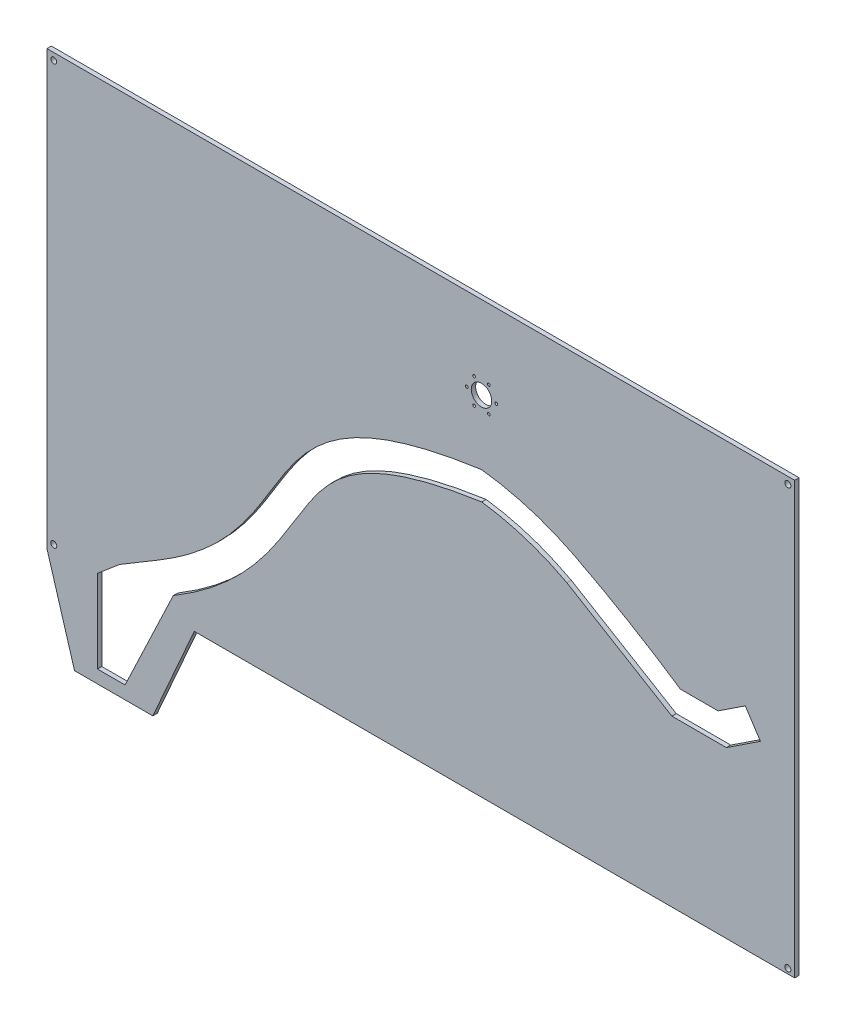
from build123d import *

# Parameters (mm, degrees)
SKETCH1_R           = 3.292374312
SKETCH1_R_2         = 3.294421934
SKETCH1_R_3         = 3.163533699
SKETCH1_R_4         = 1.5
SKETCH1_R_5         = 11.1125
BOSS_EXTRUDE1_DEPTH = 4.7625


with BuildPart() as part:
    # Sketch1 → Boss-Extrude1 (new body)
    with BuildSketch(Plane.XY):
        Polygon((-596.816755826, -150), (-566.816755826, -250), (-481.816755826, -250), (-436.816755826, -147.994392447), (215.080766979, -147.994392447), (215.080766979, 320), (-596.816755826, 320), align=None)
        with Locations((-589.375723826, -142.5578)):
            Circle(SKETCH1_R, mode=Mode.SUBTRACT)
        with Locations((207.642212326, -142.5578)):
            Circle(SKETCH1_R, mode=Mode.SUBTRACT)
        with Locations((207.642212326, 312.5578)):
            Circle(SKETCH1_R_2, mode=Mode.SUBTRACT)
        with Locations((-589.375723826, 312.5578)):
            Circle(SKETCH1_R_3, mode=Mode.SUBTRACT)
        with Locations((-141, 230)):
            Circle(SKETCH1_R_4, mode=Mode.SUBTRACT)
        with Locations((-133, 243.856406461)):
            Circle(SKETCH1_R_4, mode=Mode.SUBTRACT)
        with Locations((-117, 243.856406461)):
            Circle(SKETCH1_R_4, mode=Mode.SUBTRACT)
        with Locations((-109, 230)):
            Circle(SKETCH1_R_4, mode=Mode.SUBTRACT)
        with Locations((-117, 216.143593539)):
            Circle(SKETCH1_R_4, mode=Mode.SUBTRACT)
        with Locations((-133, 216.143593539)):
            Circle(SKETCH1_R_4, mode=Mode.SUBTRACT)
        with Locations((-125, 230)):
            Circle(SKETCH1_R_5, mode=Mode.SUBTRACT)
        with BuildLine():
            Line((-475, -100), (-518.031074044, -125.74437106))
            Line((-518.031074044, -125.74437106), (-541.975507322, -146))
            Line((-541.975507322, -146), (-541.975507322, -236))
            Line((-541.975507322, -236), (-511.975507322, -236))
            Line((-511.975507322, -236), (-459.597813184, -125.74437106))
            add(Edge.make_bspline(
                [(-459.597813184, -125.74437106), (-458.129207209, -124.865742348), (-455.185829054, -123.081513508), (-449.471359557, -119.524654219), (-442.555549408, -115.046151368), (-434.636214281, -109.639746192), (-424.556425744, -102.386073958), (-412.829398694, -93.24529863), (-400.055778993, -82.1905419), (-388.486450966, -71.092190732), (-374.537420018, -56.304576734), (-359.620141336, -37.979207276), (-344.890774823, -16.767556206), (-332.340078528, 3.245699555), (-321.055163892, 21.796443272), (-310.225956981, 38.664819129), (-299.079604806, 53.834809894), (-286.812791685, 67.514642691), (-272.431751915, 80.088460877), (-257.652665703, 89.924055398), (-243.498210685, 97.442015492), (-231.565093385, 102.886615769), (-218.172694067, 108.112662921), (-203.190999217, 113.087836875), (-189.281720356, 116.996077726), (-177.243425929, 119.962936855), (-167.745823902, 122.104113686), (-157.766000623, 124.157339904), (-149.036898589, 125.791853127), (-141.799270328, 127.051772068), (-136.243143266, 127.972296195), (-131.502167372, 128.719120718), (-127.648712651, 129.303231945), (-125.690331117, 129.592450023), (-124.714693771, 129.734664734)],
                knots=[0, 0, 0, 0, 0.00777259, 0.01554518, 0.03109036, 0.04663554, 0.062180721, 0.093271081, 0.124361441, 0.155451801, 0.186542162, 0.248722882, 0.310903603, 0.373084323, 0.435265044, 0.497445764, 0.559626485, 0.621807206, 0.683987926, 0.746168647, 0.777259007, 0.808349367, 0.839439728, 0.870530088, 0.901620448, 0.917165628, 0.932710808, 0.948255989, 0.963801169, 0.971573759, 0.979346349, 0.987118939, 0.991005234, 0.994891529, 0.994891529, 0.994891529, 0.994891529], degree=3))
            ThreePointArc((-124.714693771, 129.734664734), (-77.172123272, 119.052933104), (-32.323699215, 100))
            Line((-32.323699215, 100), (81.77450832, 31.56416045))
            Line((81.77450832, 31.56416045), (140.88780849, 31.56416045))
            Line((140.88780849, 31.56416045), (177.923308763, 55.973921994))
            Line((177.923308763, 55.973921994), (161.413907899, 81.022668132))
            Line((161.413907899, 81.022668132), (131.890654865, 61.56416045))
            Line((131.890654865, 61.56416045), (90.97120992, 61.56416045))
            ThreePointArc((90.97120992, 61.56416045), (35.57180112, 96.520479224), (-21.701372103, 128.313911667))
            Line((-21.701372103, 128.313911667), (-25, 130))
            ThreePointArc((-25, 130), (-73.684930832, 149.383563894), (-125, 160))
            add(Edge.make_bspline(
                [(-475, -100), (-419.540575809, -66.820070684), (-329.590802121, 43.11603253), (-307.635554762, 134.287094016), (-125, 160)],
                knots=[0, 0, 0, 0, 0.312223899, 1, 1, 1, 1], degree=3))
        make_face(mode=Mode.SUBTRACT)
    extrude(amount=BOSS_EXTRUDE1_DEPTH)


solid = part.part
